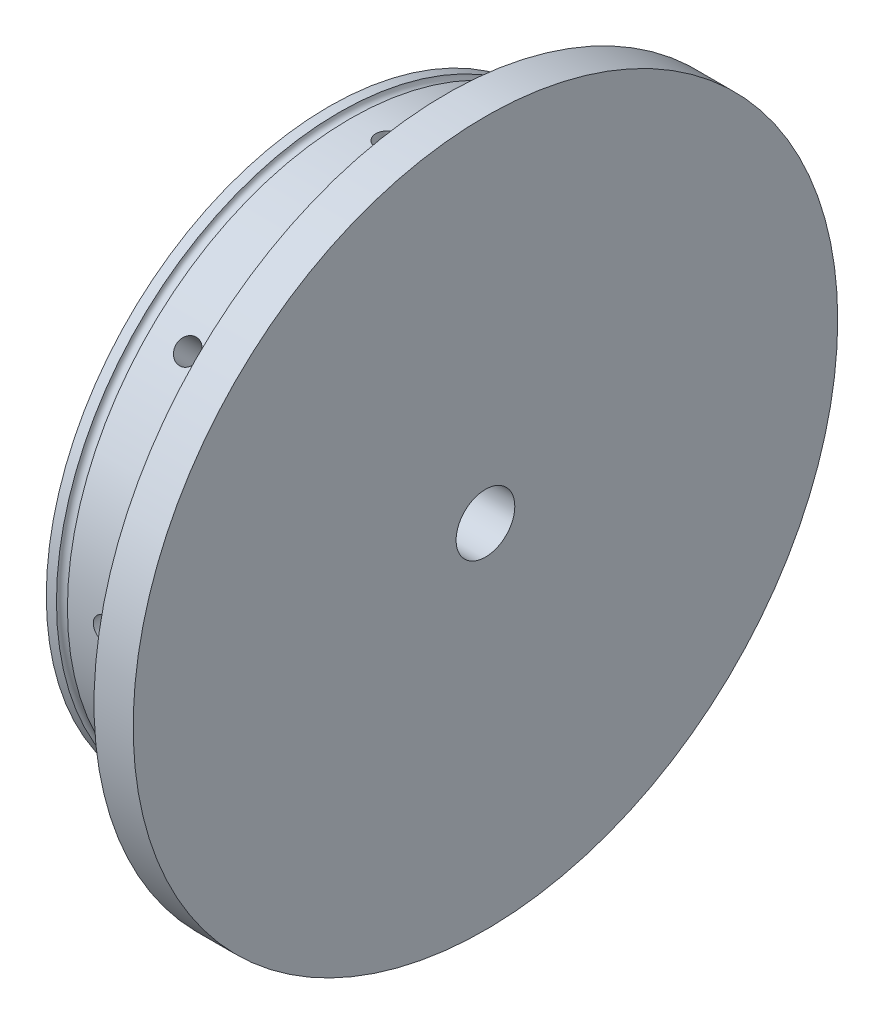
from build123d import *

# Parameters (mm, degrees)
SKETCH1_R           = 57.15
BOSS_EXTRUDE1_DEPTH = 6.35
SKETCH2_R           = 45.847
BOSS_EXTRUDE2_DEPTH = 19.05
SKETCH3_R           = 38.1762
CUT_EXTRUDE1_DEPTH  = 3.175
SKETCH8_R           = 4.7625
CUT_EXTRUDE4_DEPTH  = 85.719566807
SKETCH5_R           = 0.889
SKETCH6_R           = 1.905
CUT_EXTRUDE3_DEPTH  = 6.35
CIRPATTERN1_COUNT   = 8
SKETCH10_R          = 1.1303
CUT_EXTRUDE5_DEPTH  = 5.08


with BuildPart() as part:
    # Sketch1 → Boss-Extrude1 (new body)
    with BuildSketch(Plane(origin=(0, 0, 0), x_dir=(0, 0, -1), z_dir=(1, 0, 0))):
        Circle(SKETCH1_R)
    extrude(amount=BOSS_EXTRUDE1_DEPTH)

    # Sketch2 → Boss-Extrude2 (add)
    with BuildSketch(Plane.ZY):
        Circle(SKETCH2_R)
    extrude(amount=BOSS_EXTRUDE2_DEPTH)

    # Sketch3 → Cut-Extrude1 (cut)
    with BuildSketch(Plane.ZY.offset(19.05)):
        Circle(SKETCH3_R)
    extrude(amount=-CUT_EXTRUDE1_DEPTH, mode=Mode.SUBTRACT)

    # Sketch8 → Cut-Extrude4 (cut, through all)
    with BuildSketch(Plane(origin=(6.35, 0, 0), x_dir=(0, 0, -1), z_dir=(1, 0, 0))):
        Circle(SKETCH8_R)
    extrude(amount=-CUT_EXTRUDE4_DEPTH, mode=Mode.SUBTRACT)

    # Sketch9 → Cut-Revolve2 (revolve, cut)
    with BuildSketch(Plane.XY):
        Polygon((0, 0), (-19.05, 0), (-19.05, -14.986), align=None)
    revolve(axis=Axis((0, 0, 0), (-1, 0, 0)), mode=Mode.SUBTRACT)

    # Sketch5 → Cut-Revolve1 (revolve, cut)
    with BuildSketch(Plane.XY):
        with Locations((-16.51, 45.847)):
            Circle(SKETCH5_R)
    revolve(axis=Axis((0, 0, 0), (-1, 0, 0)), mode=Mode.SUBTRACT)

    # Sketch6 → Cut-Extrude3 (cut)
    with BuildSketch(Plane.XY.offset(45.847)):
        with Locations((-9.525, 0)):
            Circle(SKETCH6_R)
    cut_extrude3 = extrude(amount=-CUT_EXTRUDE3_DEPTH, mode=Mode.SUBTRACT)

    # CirPattern1: Cut-Extrude3 ×8 about axis
    cirpattern1_axis = Axis((-19.05, 0, 0), (1, 0, 0))
    for i in range(1, CIRPATTERN1_COUNT):
        add(cut_extrude3.rotate(cirpattern1_axis, i * 360 / CIRPATTERN1_COUNT), mode=Mode.SUBTRACT)

    # Sketch10 → Cut-Extrude5 (cut)
    with BuildSketch(Plane.ZY.offset(15.875)):
        with Locations((0, 33.3375)):
            Circle(SKETCH10_R)
        with Locations((23.573172318, 23.573172318)):
            Circle(SKETCH10_R)
        with Locations((33.3375, 0)):
            Circle(SKETCH10_R)
        with Locations((23.573172318, -23.573172318)):
            Circle(SKETCH10_R)
        with Locations((0, -33.3375)):
            Circle(SKETCH10_R)
        with Locations((-23.573172318, -23.573172318)):
            Circle(SKETCH10_R)
        with Locations((-33.3375, 0)):
            Circle(SKETCH10_R)
        with Locations((-23.573172318, 23.573172318)):
            Circle(SKETCH10_R)
    extrude(amount=-CUT_EXTRUDE5_DEPTH, mode=Mode.SUBTRACT)


solid = part.part
